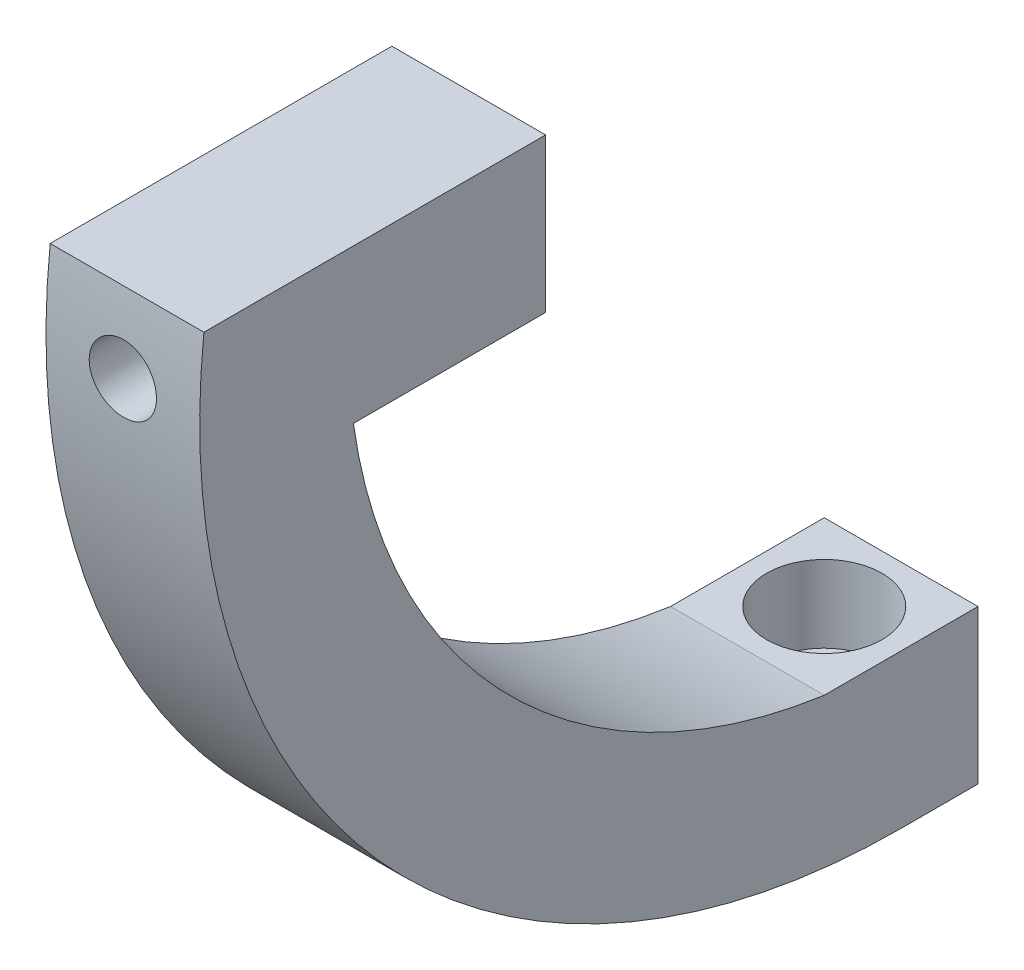
from build123d import *

# Parameters (mm, degrees)
BOSS_EXTRUDE1_DEPTH      = 4
BOSS_EXTRUDE1_DEPTH_BACK = 4
SKETCH7_R                = 1.75
CUT_EXTRUDE1_DEPTH       = 52.773545368
SKETCH8_R                = 1.75
CUT_EXTRUDE2_DEPTH       = 52.77354553
SKETCH9_R                = 3
CUT_EXTRUDE4_DEPTH       = 4
SKETCH10_R               = 3
CUT_EXTRUDE5_DEPTH       = 4


with BuildPart() as part:
    # Sketch5 → Boss-Extrude1 (new, two sides: drawn at the far end of the back side and taken through both)
    with BuildSketch(Plane(origin=(0, 0, 0), x_dir=(0, 0, -1), z_dir=(1, 0, 0)).offset(-BOSS_EXTRUDE1_DEPTH_BACK)):
        with BuildLine():
            Line((-18.5, 4), (-18.5, 0))
            Line((-18.5, 0), (-18.5, -4))
            Line((-18.5, -4), (-28.5, -4))
            ThreePointArc((-28.5, -4), (-20.350061425, -20.350061425), (-4, -28.5))
            Line((-4, -28.5), (0, -28.5))
            Line((0, -28.5), (4, -28.5))
            Line((4, -28.5), (4, -36.5))
            Line((4, -36.5), (0, -36.5))
            ThreePointArc((0, -36.5), (-27.186853441, -24.354157756), (-36.280159867, 4))
            Line((-36.280159867, 4), (-26.5, 4))
            Line((-26.5, 4), (-18.5, 4))
        make_face()
    extrude(amount=BOSS_EXTRUDE1_DEPTH + BOSS_EXTRUDE1_DEPTH_BACK)

    # Sketch7 → Cut-Extrude1 (cut, through all)
    with BuildSketch(Plane.XY):
        Circle(SKETCH7_R)
    extrude(amount=CUT_EXTRUDE1_DEPTH, mode=Mode.SUBTRACT)

    # Sketch8 → Cut-Extrude2 (cut, through all)
    with BuildSketch(Plane(origin=(0, 0, 0), x_dir=(1, 0, 0), z_dir=(0, 1, 0))):
        Circle(SKETCH8_R)
    extrude(amount=-CUT_EXTRUDE2_DEPTH, mode=Mode.SUBTRACT)

    # Sketch9 → Cut-Extrude4 (cut)
    with BuildSketch(Plane(origin=(0, -28.5, 0), x_dir=(1, 0, 0), z_dir=(0, 1, 0))):
        Circle(SKETCH9_R)
    extrude(amount=-CUT_EXTRUDE4_DEPTH, mode=Mode.SUBTRACT)

    # Sketch10 → Cut-Extrude5 (cut)
    with BuildSketch(Plane(origin=(0, 0, 18.5), x_dir=(-1, 0, 0), z_dir=(0, 0, -1))):
        Circle(SKETCH10_R)
    extrude(amount=-CUT_EXTRUDE5_DEPTH, mode=Mode.SUBTRACT)


solid = part.part
